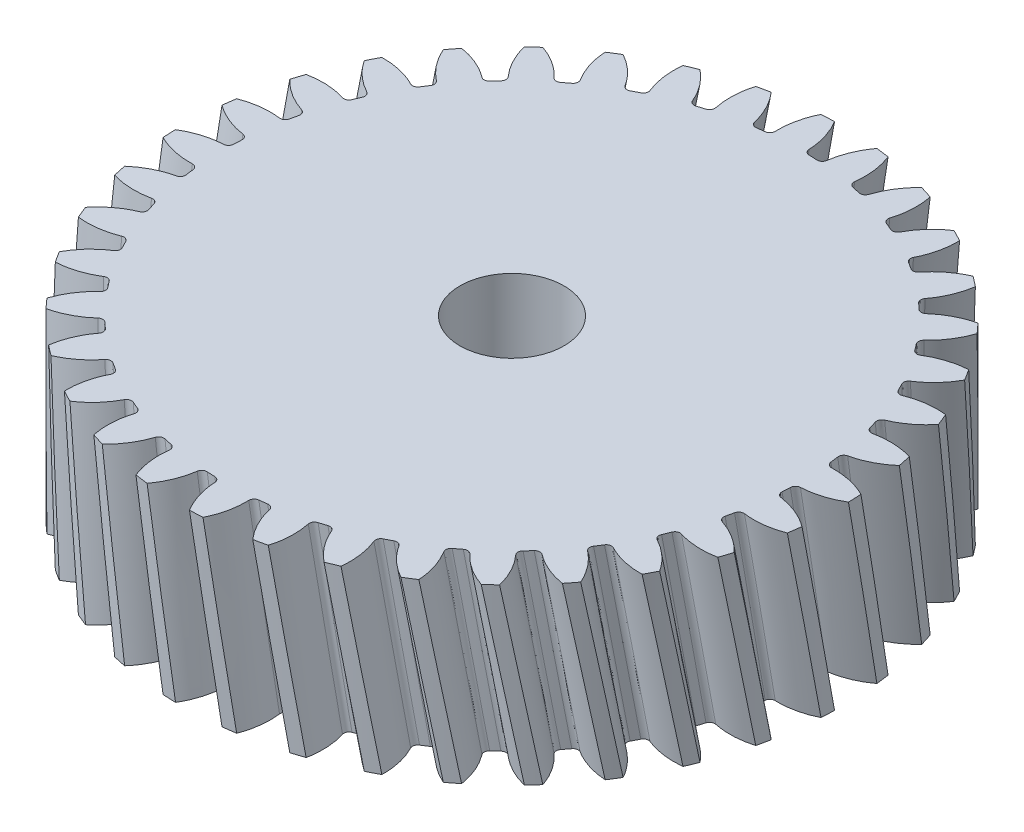
from build123d import *

# Parameters (mm, degrees)
SKETCH1_R                = 19
BOSS_EXTRUDE1_DEPTH      = 5
FILLET2_R                = 0.3
CIRPATTERN3_COUNT        = 36
FILLET2_OF_CIRPATTERN3_R = 0.3
SKETCH8_R                = 3
CUT_EXTRUDE1_DEPTH       = 29.664942132


with BuildPart() as part:
    # Sketch1 → Boss-Extrude1 (new, symmetric)
    with BuildSketch(Plane(origin=(0, 0, 0), x_dir=(1, 0, 0), z_dir=(0, 1, 0))):
        with Locations(Location((0, 0, 0), (0, 0, 270))):
            Circle(SKETCH1_R)
    extrude(amount=BOSS_EXTRUDE1_DEPTH, both=True)

    # Sketch6 for Cut-Loft1 → Cut-Loft1 section 0
    with BuildSketch(Plane(origin=(0, 5, 0), x_dir=(0.998922854639124, 0, 0.046401837028543995), z_dir=(0, 1, 0))):
        with BuildLine():
            # circular arc as an exact rational Bezier (weights 1, cos(half-angle), 1)
            Bezier((-2.121923506, 19.887117454), (-0.580085302, 18.599648079), (-0.517468727, 16.591932561), weights=[1, 0.912295305, 1])
            Bezier((-0.517468727, 16.591932561), (0, 16.608071361), (0.517468727, 16.591932561), weights=[1, 0.99951401, 1])
            Bezier((0.517468727, 16.591932561), (0.580085302, 18.599648079), (2.121923506, 19.887117454), weights=[1, 0.912295305, 1])
            Bezier((2.121923506, 19.887117454), (0, 20.113523286), (-2.121923506, 19.887117454), weights=[1, 0.994355873, 1])
        make_face()
    # Sketch2 for Cut-Loft1 → Cut-Loft1 section 1
    with BuildSketch(Plane(origin=(0, 0, 0), x_dir=(1, 0, 0), z_dir=(0, 1, 0))):
        with BuildLine():
            Bezier((-2.121923506, 19.887117454), (-0.580085302, 18.599648079), (-0.517468727, 16.591932561), weights=[1, 0.912295305, 1])
            Bezier((-0.517468727, 16.591932561), (0, 16.608071361), (0.517468727, 16.591932561), weights=[1, 0.99951401, 1])
            Bezier((0.517468727, 16.591932561), (0.580085302, 18.599648079), (2.121923506, 19.887117454), weights=[1, 0.912295305, 1])
            Bezier((2.121923506, 19.887117454), (0, 20.113523286), (-2.121923506, 19.887117454), weights=[1, 0.994355873, 1])
        make_face()
    # Sketch7 for Cut-Loft1 → Cut-Loft1 section 2
    with BuildSketch(Plane(origin=(0, -5, 0), x_dir=(0.998922854639124, 0, -0.04640183702854388), z_dir=(0, 1, 0))):
        with BuildLine():
            Bezier((-2.121923506, 19.887117454), (-0.580085302, 18.599648079), (-0.517468727, 16.591932561), weights=[1, 0.912295305, 1])
            Bezier((-0.517468727, 16.591932561), (0, 16.608071361), (0.517468727, 16.591932561), weights=[1, 0.99951401, 1])
            Bezier((0.517468727, 16.591932561), (0.580085302, 18.599648079), (2.121923506, 19.887117454), weights=[1, 0.912295305, 1])
            Bezier((2.121923506, 19.887117454), (0, 20.113523286), (-2.121923506, 19.887117454), weights=[1, 0.994355873, 1])
        make_face()
    cut_loft1 = loft(mode=Mode.SUBTRACT)

    # Fillet2
    fillet2_edges = [part.edges().sort_by_distance(p)[0] for p in [
        (0.517468727, 0, -16.591932561),
        (-0.517468727, 0, -16.591932561),
    ]]
    fillet(fillet2_edges, radius=FILLET2_R)

    # CirPattern3: Cut-Loft1 ×36 about axis
    cirpattern3_axis = Axis((0, 5, 0), (0, -1, 0))
    for i in range(1, CIRPATTERN3_COUNT):
        add(cut_loft1.rotate(cirpattern3_axis, i * 360 / CIRPATTERN3_COUNT), mode=Mode.SUBTRACT)

    # Fillet2 of CirPattern3
    fillet2_of_cirpattern3_edges = [part.edges().sort_by_distance(p)[0] for p in [
        (3.390766068, 0, -16.250006322),
        (2.371551639, 0, -16.429721325),
        (6.161036697, 0, -15.414331864),
        (5.188513608, 0, -15.768301321),
        (8.744107344, 0, -14.110300732),
        (7.847825217, 0, -14.627769459),
        (11.061492714, 0, -12.377535253),
        (10.268684628, 0, -13.042780225),
        (13.042780225, 0, -10.268684628),
        (12.377535253, 0, -11.061492714),
        (14.627769459, 0, -7.847825217),
        (14.110300732, 0, -8.744107344),
        (15.768301321, 0, -5.188513608),
        (15.414331864, 0, -6.161036697),
        (16.429721325, 0, -2.371551639),
        (16.250006322, 0, -3.390766068),
        (16.591932561, 0, 0.517468727),
        (16.591932561, 0, -0.517468727),
        (16.250006322, 0, 3.390766068),
        (16.429721325, 0, 2.371551639),
        (15.414331864, 0, 6.161036697),
        (15.768301321, 0, 5.188513608),
        (14.110300732, 0, 8.744107344),
        (14.627769459, 0, 7.847825217),
        (12.377535253, 0, 11.061492714),
        (13.042780225, 0, 10.268684628),
        (10.268684628, 0, 13.042780225),
        (11.061492714, 0, 12.377535253),
        (7.847825217, 0, 14.627769459),
        (8.744107344, 0, 14.110300732),
        (5.188513608, 0, 15.768301321),
        (6.161036697, 0, 15.414331864),
        (2.371551639, 0, 16.429721325),
        (3.390766068, 0, 16.250006322),
        (-0.517468727, 0, 16.591932561),
        (0.517468727, 0, 16.591932561),
        (-3.390766068, 0, 16.250006322),
        (-2.371551639, 0, 16.429721325),
        (-6.161036697, 0, 15.414331864),
        (-5.188513608, 0, 15.768301321),
        (-8.744107344, 0, 14.110300732),
        (-7.847825217, 0, 14.627769459),
        (-11.061492714, 0, 12.377535253),
        (-10.268684628, 0, 13.042780225),
        (-13.042780225, 0, 10.268684628),
        (-12.377535253, 0, 11.061492714),
        (-14.627769459, 0, 7.847825217),
        (-14.110300732, 0, 8.744107344),
        (-15.768301321, 0, 5.188513608),
        (-15.414331864, 0, 6.161036697),
        (-16.429721325, 0, 2.371551639),
        (-16.250006322, 0, 3.390766068),
        (-16.591932561, 0, -0.517468727),
        (-16.591932561, 0, 0.517468727),
        (-16.250006322, 0, -3.390766068),
        (-16.429721325, 0, -2.371551639),
        (-15.414331864, 0, -6.161036697),
        (-15.768301321, 0, -5.188513608),
        (-14.110300732, 0, -8.744107344),
        (-14.627769459, 0, -7.847825217),
        (-12.377535253, 0, -11.061492714),
        (-13.042780225, 0, -10.268684628),
        (-10.268684628, 0, -13.042780225),
        (-11.061492714, 0, -12.377535253),
        (-7.847825217, 0, -14.627769459),
        (-8.744107344, 0, -14.110300732),
        (-5.188513608, 0, -15.768301321),
        (-6.161036697, 0, -15.414331864),
        (-2.371551639, 0, -16.429721325),
        (-3.390766068, 0, -16.250006322),
    ]]
    fillet(fillet2_of_cirpattern3_edges, radius=FILLET2_OF_CIRPATTERN3_R)

    # Sketch8 → Cut-Extrude1 (cut, through all)
    with BuildSketch(Plane(origin=(0, 5, 0), x_dir=(1, 0, 0), z_dir=(0, 1, 0))):
        with Locations(Location((0, 0, 0), (0, 0, 270))):
            Circle(SKETCH8_R)
    extrude(amount=-CUT_EXTRUDE1_DEPTH, mode=Mode.SUBTRACT)


solid = part.part
